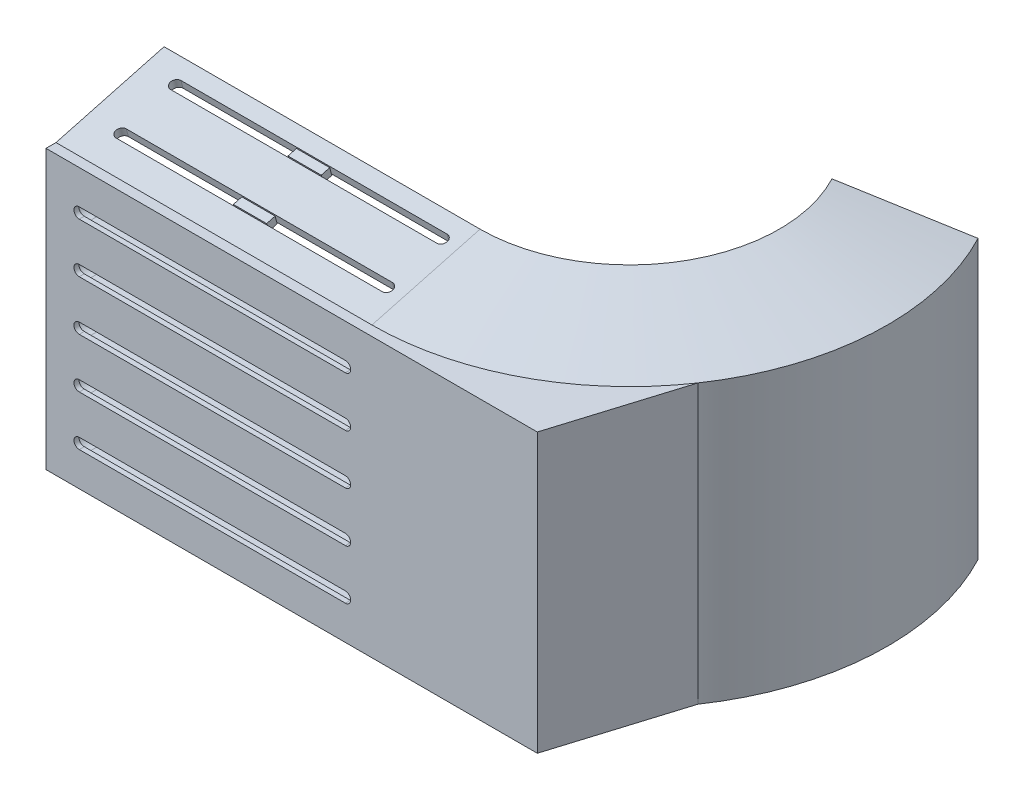
from build123d import *

# Parameters (mm, degrees)
CUT_EXTRUDE1_DEPTH    = 2.5
BOSS_EXTRUDE1_START   = -3
SKETCH7_W             = 95
SKETCH7_H             = 83.660254038
BOSS_EXTRUDE1_DEPTH   = 3
CUT_EXTRUDE2_DEPTH    = 4
CUT_EXTRUDE3_DEPTH    = 105.15629562
SKETCH13_W            = 10
SKETCH13_H            = 2.64
BOSS_EXTRUDE2_DEPTH   = 2.414814566
BOSS_EXTRUDE2_2_DEPTH = 2.414814566


with BuildPart() as part:
    # Sweep1: sweep along a path in Sketch2
    with BuildLine(Plane(origin=(0, 0, 0), x_dir=(1, 0, 0), z_dir=(0, 1, 0))) as sweep1_path:
        Line((0, 0), (95, 0))
        ThreePointArc((95, 0), (159.226162893, 36.270166538), (161.332495807, 110))
    # Sketch4 → Sweep1 (sweep)
    with BuildSketch(Plane(origin=(0, 0, 0), x_dir=(0, 0, -1), z_dir=(1, 0, 0))):
        Polygon((0, -40), (0, 40), (30, 48.038475773), (30, 50.538475773), (-2.5, 41.830127019), (-2.5, -41.830127019), (30, -50.538475773), (30, -48.038475773), align=None)
    sweep(path=sweep1_path.line)

    # Sketch6 → Cut-Extrude1 (cut)
    with BuildSketch(Plane(origin=(53, 0, 2.5), x_dir=(-1, 0, 0), z_dir=(0, 0, -1))):
        with BuildLine():
            Line((43, 28.4), (-37, 28.4))
            ThreePointArc((-37, 28.4), (-38.6, 30), (-37, 31.6))
            Line((-37, 31.6), (43, 31.6))
            ThreePointArc((43, 31.6), (44.6, 30), (43, 28.4))
        make_face()
        with BuildLine():
            Line((43, -1.6), (-37, -1.6))
            ThreePointArc((-37, -1.6), (-38.6, 0), (-37, 1.6))
            Line((-37, 1.6), (43, 1.6))
            ThreePointArc((43, 1.6), (44.6, 0), (43, -1.6))
        make_face()
        with BuildLine():
            Line((43, -31.6), (-37, -31.6))
            ThreePointArc((-37, -31.6), (-38.6, -30), (-37, -28.4))
            Line((-37, -28.4), (43, -28.4))
            ThreePointArc((43, -28.4), (44.6, -30), (43, -31.6))
        make_face()
        with BuildLine():
            Line((43, -16.6), (-37, -16.6))
            ThreePointArc((-37, -16.6), (-38.6, -15), (-37, -13.4))
            Line((-37, -13.4), (43, -13.4))
            ThreePointArc((43, -13.4), (44.6, -15), (43, -16.6))
        make_face()
        with BuildLine():
            Line((43, 13.4), (-37, 13.4))
            ThreePointArc((-37, 13.4), (-38.6, 15), (-37, 16.6))
            Line((-37, 16.6), (43, 16.6))
            ThreePointArc((43, 16.6), (44.6, 15), (43, 13.4))
        make_face()
    extrude(amount=CUT_EXTRUDE1_DEPTH, mode=Mode.SUBTRACT)

    # Sketch7 → Boss-Extrude1 (add)
    with BuildSketch(Plane(origin=(50, 0, 2.5), x_dir=(-1, 0, 0), z_dir=(0, 0, -1)).offset(BOSS_EXTRUDE1_START)):
        with Locations((2.5, 0)):
            Rectangle(SKETCH7_W, SKETCH7_H)
        with BuildLine():
            Line((-40, 31.6), (40, 31.6))
            ThreePointArc((40, 31.6), (41.6, 30), (40, 28.4))
            Line((40, 28.4), (-40, 28.4))
            ThreePointArc((-40, 28.4), (-41.6, 30), (-40, 31.6))
        make_face(mode=Mode.SUBTRACT)
        with BuildLine():
            Line((-40, 16.6), (40, 16.6))
            ThreePointArc((40, 16.6), (41.6, 15), (40, 13.4))
            Line((40, 13.4), (-40, 13.4))
            ThreePointArc((-40, 13.4), (-41.6, 15), (-40, 16.6))
        make_face(mode=Mode.SUBTRACT)
        with BuildLine():
            Line((40, -1.6), (-40, -1.6))
            ThreePointArc((-40, -1.6), (-41.6, 0), (-40, 1.6))
            Line((-40, 1.6), (40, 1.6))
            ThreePointArc((40, 1.6), (41.6, 0), (40, -1.6))
        make_face(mode=Mode.SUBTRACT)
        with BuildLine():
            Line((-40, -13.4), (40, -13.4))
            ThreePointArc((40, -13.4), (41.6, -15), (40, -16.6))
            Line((40, -16.6), (-40, -16.6))
            ThreePointArc((-40, -16.6), (-41.6, -15), (-40, -13.4))
        make_face(mode=Mode.SUBTRACT)
        with BuildLine():
            Line((-40, -28.4), (40, -28.4))
            ThreePointArc((40, -28.4), (41.6, -30), (40, -31.6))
            Line((40, -31.6), (-40, -31.6))
            ThreePointArc((-40, -31.6), (-41.6, -30), (-40, -28.4))
        make_face(mode=Mode.SUBTRACT)
    extrude(amount=BOSS_EXTRUDE1_DEPTH)

    # Sketch9 → Cut-Extrude2 (cut)
    with BuildSketch(Plane(origin=(50, 0, 0), x_dir=(-1, 0, 0), z_dir=(0, 0, -1))):
        with BuildLine():
            Line((-40, 33.6), (40, 33.6))
            ThreePointArc((40, 33.6), (43.6, 30), (40, 26.4))
            Line((40, 26.4), (-40, 26.4))
            ThreePointArc((-40, 26.4), (-43.6, 30), (-40, 33.6))
        make_face()
        with BuildLine():
            Line((-40, 18.6), (40, 18.6))
            ThreePointArc((40, 18.6), (43.6, 15), (40, 11.4))
            Line((40, 11.4), (-40, 11.4))
            ThreePointArc((-40, 11.4), (-43.6, 15), (-40, 18.6))
        make_face()
        with BuildLine():
            Line((-40, 3.6), (40, 3.6))
            ThreePointArc((40, 3.6), (43.6, 0), (40, -3.6))
            Line((40, -3.6), (-40, -3.6))
            ThreePointArc((-40, -3.6), (-43.6, 0), (-40, 3.6))
        make_face()
        with BuildLine():
            Line((-40, -11.4), (40, -11.4))
            ThreePointArc((40, -11.4), (43.6, -15), (40, -18.6))
            Line((40, -18.6), (-40, -18.6))
            ThreePointArc((-40, -18.6), (-43.6, -15), (-40, -11.4))
        make_face()
        with BuildLine():
            Line((-40, -26.4), (40, -26.4))
            ThreePointArc((40, -26.4), (43.6, -30), (40, -33.6))
            Line((40, -33.6), (-40, -33.6))
            ThreePointArc((-40, -33.6), (-43.6, -30), (-40, -26.4))
        make_face()
    extrude(amount=-CUT_EXTRUDE2_DEPTH, mode=Mode.SUBTRACT)

    # Sketch10 → Cut-Extrude3 (cut)
    with BuildSketch(Plane(origin=(51.866025404, 52.619546181, -37.766660498), x_dir=(0, -0.2588190451025259, 0.965925826289067), z_dir=(0, -0.965925826289067, -0.2588190451025259))):
        with BuildLine():
            Line((16.340638615, 41.866025404), (16.340638615, -38.133974596))
            ThreePointArc((16.340638615, -38.133974596), (14.740638615, -39.733974596), (13.140638615, -38.133974596))
            Line((13.140638615, -38.133974596), (13.140638615, 41.866025404))
            ThreePointArc((13.140638615, 41.866025404), (14.740638615, 43.466025404), (16.340638615, 41.866025404))
        make_face()
        with BuildLine():
            Line((33.340638615, 41.866025404), (33.340638615, -38.133974596))
            ThreePointArc((33.340638615, -38.133974596), (31.740638615, -39.733974596), (30.140638615, -38.133974596))
            Line((30.140638615, -38.133974596), (30.140638615, 41.866025404))
            ThreePointArc((30.140638615, 41.866025404), (31.740638615, 43.466025404), (33.340638615, 41.866025404))
        make_face()
    cut_extrude3 = extrude(amount=CUT_EXTRUDE3_DEPTH, mode=Mode.SUBTRACT)

    # Chamfer1
    # the kernel refuses this chamfer: 370 mm, written as the material it adds along each edge
    with BuildSketch(Plane(origin=(95, 41.830127019, 2.5), x_dir=(-0.02311618515334583, 0, 0.9997327852901275), z_dir=(0, -1, 0))) as chamfer1_piece_1_section:
        with BuildLine():
            Line((174.160123938, -4.026993743), (-35.380524296, -63.277258154))
            ThreePointArc((-35.380524296, -63.277258154), (-13.18277005, -41.477507792), (0, 0))
            Line((0, 0), (174.160123938, -4.026993743))
        make_face()
    chamfer1_piece_1 = extrude(amount=83.660254038, mode=Mode.PRIVATE)
    chamfer1_piece_1 = split(chamfer1_piece_1, bisect_by=Plane(origin=(121.511498595, 41.56256682, 5.5), z_dir=(0, 0, -1)), keep=Keep.TOP, mode=Mode.PRIVATE)
    add(chamfer1_piece_1)

    # Mirror1: Cut-Extrude3 across plane
    add(cut_extrude3.mirror(Plane.ZX), mode=Mode.SUBTRACT)


with BuildPart() as body_2:
    # Sketch13 → Boss-Extrude2 (new body)
    with BuildSketch(Plane(origin=(0, 39.65303983, 10.625), x_dir=(1, 0, 0), z_dir=(0, 0.965925826289067, 0.2588190451025258))):
        with Locations((50, 18.358094829)):
            Rectangle(SKETCH13_W, SKETCH13_H)
    extrude(amount=-BOSS_EXTRUDE2_DEPTH)


with BuildPart() as body_3:
    # Sketch13 → Boss-Extrude2 2 (new body)
    with BuildSketch(Plane(origin=(0, 39.65303983, 10.625), x_dir=(1, 0, 0), z_dir=(0, 0.965925826289067, 0.2588190451025258))):
        with Locations((50, 35.358094829)):
            Rectangle(SKETCH13_W, SKETCH13_H)
    extrude(amount=-BOSS_EXTRUDE2_2_DEPTH)


with BuildPart() as body_4:
    # Mirror3: mirrored copy
    add(body_3.part.mirror(Plane.ZX))


with BuildPart() as body_5:
    # Mirror3 2: mirrored copy
    add(body_2.part.mirror(Plane.ZX))


solid = Compound([part.part, body_2.part, body_3.part, body_4.part, body_5.part])
